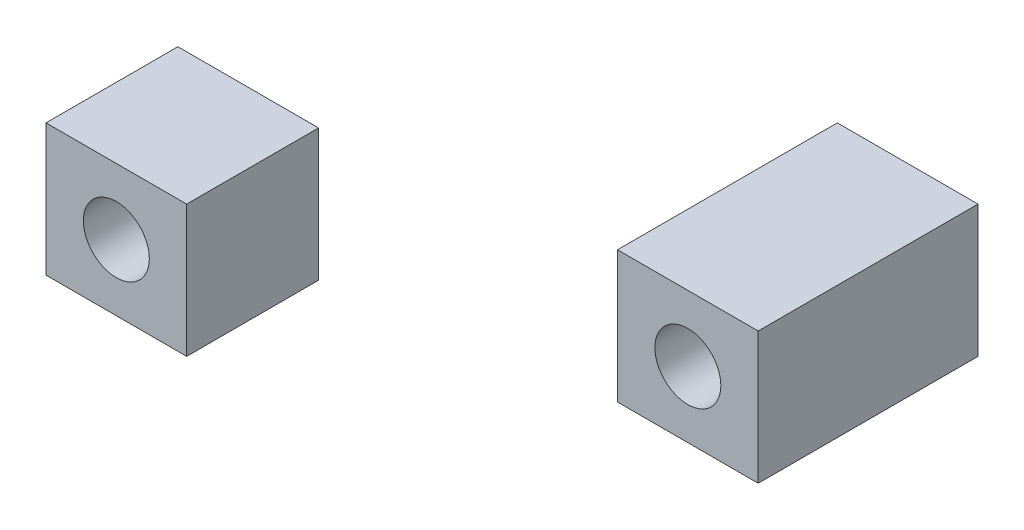
from build123d import *

# Parameters (mm, degrees)
SKETCH1_W           = 32
SKETCH1_H           = 30
SKETCH1_R           = 7.5
BOSS_EXTRUDE1_DEPTH = 25
BOSS_EXTRUDE2_START = 50
SKETCH1_3_W         = 32
SKETCH1_3_H         = 30
SKETCH1_3_R         = 7.5
BOSS_EXTRUDE2_DEPTH = 15


with BuildPart() as part:
    # Sketch1 → Boss-Extrude1 (new, symmetric)
    with BuildSketch(Plane.XY):
        with Locations((40, 35)):
            Rectangle(SKETCH1_W, SKETCH1_H)
        with Locations((40, 35)):
            Circle(SKETCH1_R, mode=Mode.SUBTRACT)
    extrude(amount=BOSS_EXTRUDE1_DEPTH, both=True)


with BuildPart() as body_2:
    # Sketch1<3> → Boss-Extrude2 (new, symmetric)
    with BuildSketch(Plane.XY.offset(BOSS_EXTRUDE2_START)):
        with Locations((-50, 35)):
            Rectangle(SKETCH1_3_W, SKETCH1_3_H)
        with Locations((-50, 35)):
            Circle(SKETCH1_3_R, mode=Mode.SUBTRACT)
    extrude(amount=BOSS_EXTRUDE2_DEPTH, both=True)


solid = Compound([part.part, body_2.part])
